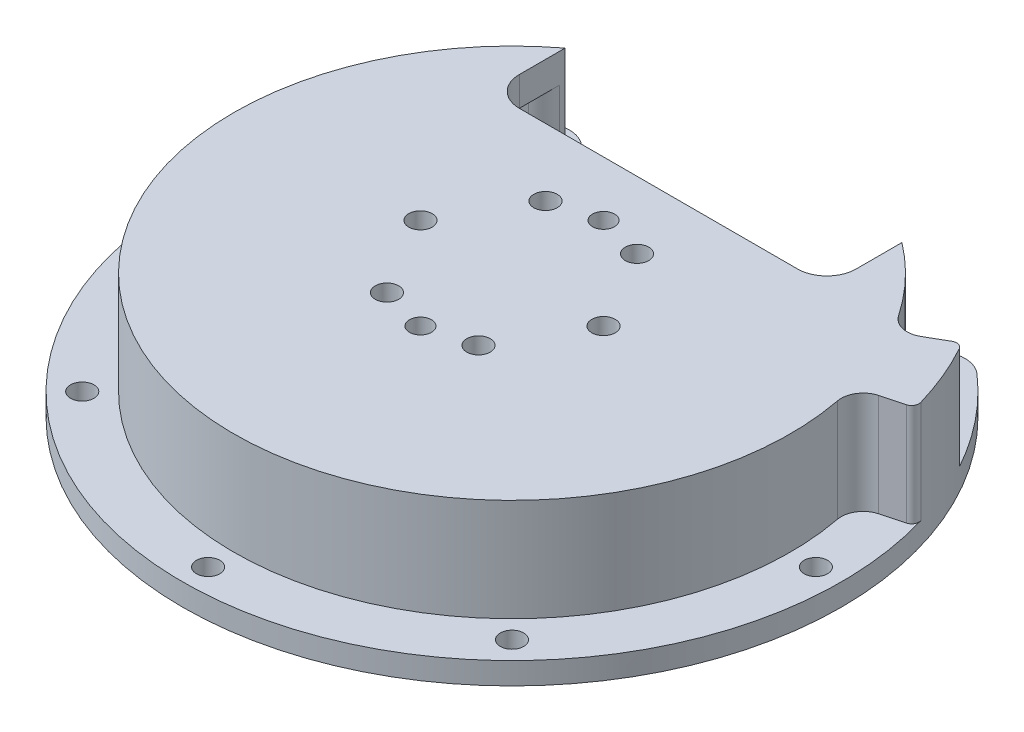
from build123d import *

# Parameters (mm, degrees)
EXTRUDE_1_DEPTH             = 3
EXTRUDE_2_DEPTH             = 14
CUT_EXTRUDE_1_REACH         = 66.954
SKETCH_5_W                  = 36
SKETCH_5_H                  = 13
HOLE_WIZARD_3_0_3_1_D       = 3
HOLE_WIZARD_3_0_3_1_DEPTH   = 3
HOLE_WIZARD_3_0_3_1_TIP     = 0.901290929
HOLE_WIZARD_3_2_3_2_1_D     = 3.2
HOLE_WIZARD_3_2_3_2_1_DEPTH = 17
HOLE_WIZARD_3_2_3_2_2_D     = 3.2
CHAMFER_1_SIZE              = 1.55
FILLET_1_R                  = 1
FILLET_2_R                  = 3
FILLET_3_R                  = 4


with BuildPart() as part:
    # Эскиз1 → Бобышка-Вытянуть1 (new body)
    with BuildSketch(Plane(origin=(0, 17, 0), x_dir=(1, 0, 0), z_dir=(0, 1, 0))):
        with BuildLine():
            Line((23, 30.854497241), (23, 27.694764848))
            ThreePointArc((23, 27.694764848), (0, 36), (-23, 27.694764848))
            Line((-23, 27.694764848), (-23, 30.854497241))
            ThreePointArc((-23, 30.854497241), (-25.347212259, 34.497064012), (-29.634146341, 33.864692094))
            ThreePointArc((-29.634146341, 33.864692094), (0, -45), (29.634146341, 33.864692094))
            ThreePointArc((29.634146341, 33.864692094), (25.347212259, 34.497064012), (23, 30.854497241))
        make_face()
    extrude(amount=-EXTRUDE_1_DEPTH)

    # Эскиз2 → Бобышка-Вытянуть2 (add)
    with BuildSketch(Plane.XZ.offset(-14)):
        with BuildLine():
            Line((-23, -27.694764848), (-23, -30.248966925))
            ThreePointArc((-23, -30.248966925), (-12.293870341, 35.956372899), (36.705181399, -9.835123714))
            Line((36.705181399, -9.835123714), (43.466662183, -11.64685703))
            ThreePointArc((43.466662183, -11.64685703), (41.574578963, -17.220754456), (38.97114317, -22.5))
            Line((38.97114317, -22.5), (32.908965344, -19))
            ThreePointArc((32.908965344, -19), (28.514696486, -25.117963379), (23, -30.248966925))
            Line((23, -30.248966925), (23, -27.694764848))
            ThreePointArc((23, -27.694764848), (0, -36), (-23, -27.694764848))
        make_face()
    extrude(amount=EXTRUDE_2_DEPTH)

    # Эскиз4 → Вырез-Вытянуть1 (cut, up to next)
    with BuildSketch(Plane(origin=(0, 4, 0), x_dir=(1, 0, 0), z_dir=(0, 1, 0)), mode=Mode.PRIVATE) as cut_extrude_1_sk1:
        with BuildLine():
            Line((-23, 27.694764848), (-23, 20))
            Line((-23, 20), (23, 20))
            Line((23, 20), (23, 27.694764848))
            ThreePointArc((23, 27.694764848), (0, 36), (-23, 27.694764848))
        make_face()
    cut_extrude_1_tool1 = extrude(cut_extrude_1_sk1.sketch, amount=-CUT_EXTRUDE_1_REACH, mode=Mode.PRIVATE) & part.part
    add(cut_extrude_1_tool1.solids().sort_by_distance((0, 4, -26.906646))[0], mode=Mode.SUBTRACT)

    # Эскиз5 → Вырез-Повернуть1 (revolve, cut)
    with BuildSketch(Plane(origin=(0, 0, 0), x_dir=(-1, 0, 0), z_dir=(0, 0, -1))):
        with Locations((-18, 10.5)):
            Rectangle(SKETCH_5_W, SKETCH_5_H)
    revolve(axis=Axis((0, 4, 0), (0, 1, 0)), mode=Mode.SUBTRACT)

    # Диаметр отверстия Ø3.0 (3)1
    with Locations(Plane(origin=(0, 0, 0), x_dir=(-1, 0, 0), z_dir=(0, -1, 0))):
        with Locations((0, -12.5), (0, 12.5)):
            Hole(HOLE_WIZARD_3_0_3_1_D / 2, depth=HOLE_WIZARD_3_0_3_1_DEPTH)
            with Locations((0, 0, -(HOLE_WIZARD_3_0_3_1_DEPTH + HOLE_WIZARD_3_0_3_1_TIP / 2))):  # 118° drill point
                Cone(0, HOLE_WIZARD_3_0_3_1_D / 2, HOLE_WIZARD_3_0_3_1_TIP, mode=Mode.SUBTRACT)

    # Диаметр отверстия Ø3.2 (3.2)1
    with Locations(Plane(origin=(0, 17, 0), x_dir=(1, 0, 0), z_dir=(0, 1, 0))):
        with Locations((29.344931419, -29.344931419), (0, -41.5), (-29.344931419, -29.344931419), (-41.5, 0), (-29.344931419, 29.344931419), (29.344931419, 29.344931419), (41.5, 0)):
            Hole(HOLE_WIZARD_3_2_3_2_1_D / 2, depth=HOLE_WIZARD_3_2_3_2_1_DEPTH)

    # Диаметр отверстия Ø3.2 (3.2)2 (through all)
    with Locations(Plane(origin=(0, 4, 0), x_dir=(1, 0, 0), z_dir=(0, 1, 0))):
        with Locations((-6.25, -10.825317547), (6.25, -10.825317547), (12.5, 0), (6.25, 10.825317547), (-6.25, 10.825317547), (-12.5, 0)):
            Hole(HOLE_WIZARD_3_2_3_2_2_D / 2)

    # Фаска1
    chamfer_1_edges = [part.edges().sort_by_distance(p)[0] for p in [
        (-10.9, 4, 0),
        (-4.65, 4, -10.825317547),
        (7.85, 4, -10.825317547),
        (14.1, 4, 0),
        (7.85, 4, 10.825317547),
        (-4.65, 4, 10.825317547),
    ]]
    chamfer(chamfer_1_edges, length=CHAMFER_1_SIZE)

    # Скругление1
    # the kernel refuses this fillet: 1 mm, written as the material it takes off along each edge
    with BuildSketch(Plane(origin=(38.97114317, 14, -22.5), x_dir=(-0.8660254037844388, 0, 0.4999999999999999), z_dir=(0, -1, 0))) as fillet_1_piece_1:
        with BuildLine():
            CenterArc((1.011365104, -1), FILLET_1_R, 90, 91.302288935)
            ThreePointArc((0.011623402, -1.022727273), (0.002905944, -0.511396661), (0, 0))
            Line((0, 0), (1.011365104, 0))
        make_face()
    extrude(amount=16.556983303, mode=Mode.SUBTRACT)
    with BuildSketch(Plane(origin=(43.466662183, 14, -11.64685703), x_dir=(-0.9659258262890692, 0, 0.2588190451025174), z_dir=(0, -1, 0))) as fillet_1_piece_2:
        with BuildLine():
            CenterArc((1.011365104, 1), FILLET_1_R, 178.697711065, 91.302288935)
            ThreePointArc((0.011623402, 1.022727273), (0.002905944, 0.511396661), (0, 0))
            Line((0, 0), (1.011365104, 0))
        make_face()
    extrude(amount=16.556983303, mode=Mode.SUBTRACT)

    # Скругление2
    fillet_2_edges = [part.edges().sort_by_distance(p)[0] for p in [
        (32.908965344, 7, -19),
        (36.705181399, 7, -9.835123714),
    ]]
    fillet(fillet_2_edges, radius=FILLET_2_R)

    # Скругление3
    fillet_3_edges = [part.edges().sort_by_distance(p)[0] for p in [
        (23, 10.5, -27.694764848),
        (-23, 10.5, -27.694764848),
        (-23, 2, -20),
        (23, 2, -20),
    ]]
    fillet(fillet_3_edges, radius=FILLET_3_R)


with BuildPart() as body_2:
    # Зеркальное отражение1: mirrored copy
    add(part.part.mirror(Plane(origin=(27, 17, -30.854497241), x_dir=(0, 0, 1), z_dir=(0, 1, 0))))


solid = body_2.part
